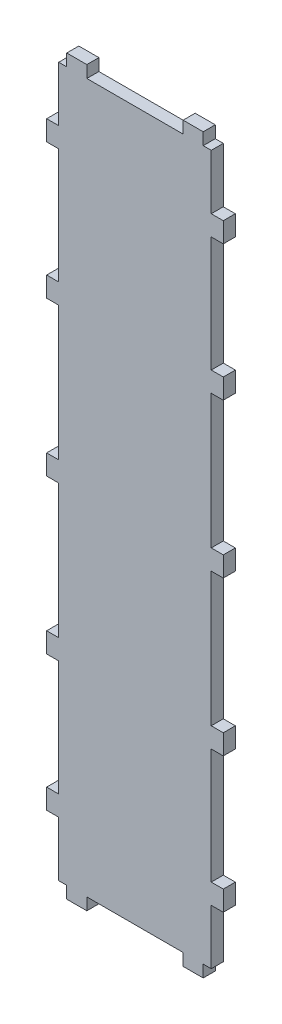
from build123d import *

# Parameters (mm, degrees)
SKETCH1_W           = 263.75
SKETCH1_H           = 1094.236516538
BOSS_EXTRUDE1_DEPTH = 18
SKETCH2_W           = 18
SKETCH2_H           = 200
SKETCH2_H_2         = 172.118258269
CUT_EXTRUDE2_DEPTH  = 18


with BuildPart() as part:
    # Sketch1 → Boss-Extrude1 (new body)
    with BuildSketch(Plane.XY):
        with Locations((-43.875, 362.922706453)):
            Rectangle(SKETCH1_W, SKETCH1_H)
    extrude(amount=BOSS_EXTRUDE1_DEPTH)

    # Sketch2 → Cut-Extrude2 (cut)
    with BuildSketch(Plane(origin=(0, 0, 0), x_dir=(-1, 0, 0), z_dir=(0, 0, -1))):
        with Locations((166.75, 247.922706453)):
            Rectangle(SKETCH2_W, SKETCH2_H)
        Polygon((175.75, -184.195551816), (145.75, -184.195551816), (145.75, -166.195551816), (157.75, -166.195551816), (157.75, -84.195551816), (175.75, -84.195551816), align=None)
        Polygon((115.75, -166.195551816), (43.875, -166.195551816), (-28, -166.195551816), (-28, -184.195551816), (115.75, -184.195551816), align=None)
        with Locations((166.75, 31.863577318)):
            Rectangle(SKETCH2_W, SKETCH2_H_2)
        with Locations((-79, 247.922706453)):
            Rectangle(SKETCH2_W, SKETCH2_H)
        with Locations((-79, 31.863577318)):
            Rectangle(SKETCH2_W, SKETCH2_H_2)
        Polygon((-70, -84.195551816), (-88, -84.195551816), (-88, -184.195551816), (-58, -184.195551816), (-58, -166.195551816), (-70, -166.195551816), align=None)
        with Locations((-79, 477.922706453)):
            Rectangle(SKETCH2_W, SKETCH2_H)
        Polygon((-88, 910.040964722), (-58, 910.040964722), (-58, 892.040964722), (-70, 892.040964722), (-70, 810.040964722), (-88, 810.040964722), align=None)
        Polygon((-28, 892.040964722), (43.875, 892.040964722), (115.75, 892.040964722), (115.75, 910.040964722), (-28, 910.040964722), align=None)
        with Locations((-79, 693.981835587)):
            Rectangle(SKETCH2_W, SKETCH2_H_2)
        with Locations((166.75, 477.922706453)):
            Rectangle(SKETCH2_W, SKETCH2_H)
        with Locations((166.75, 693.981835587)):
            Rectangle(SKETCH2_W, SKETCH2_H_2)
        Polygon((157.75, 810.040964722), (175.75, 810.040964722), (175.75, 910.040964722), (145.75, 910.040964722), (145.75, 892.040964722), (157.75, 892.040964722), align=None)
    extrude(amount=-CUT_EXTRUDE2_DEPTH, mode=Mode.SUBTRACT)


solid = part.part
